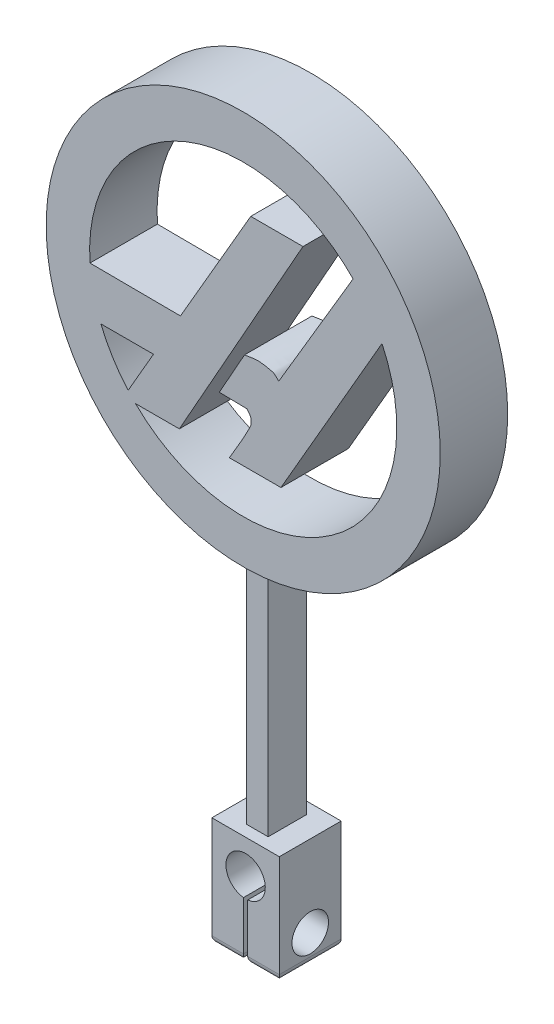
from build123d import *

# Parameters (mm, degrees)
JOINT_DEPTH         = 2.2
JOINT_DEPTH_BACK    = 2.2
SKETCH1_W           = 4.8
SKETCH1_H           = 7.77
SKETCH2_W           = 1.55
SKETCH2_H           = 2.74
ARM_DEPTH           = 19.2
MOTSHAFT_DEPTH      = 2.2
MOTSHAFT_DEPTH_BACK = 2.2
SKETCH3_R           = 1.4
BOLT_DEPTH          = 2.4
BOLT_DEPTH_BACK     = 2.4
SKETCH4_R           = 1.3
SLOT_DEPTH          = 2.4
SLOT_DEPTH_BACK     = 2.4
SKETCH5_W           = 0.3
SKETCH5_H           = 4.750114644
LOGO_DEPTH          = 2.4
LOGO_DEPTH_BACK     = 2.4
SKETCH6_R           = 14.025069588
FILLET2_R           = 0.5


with BuildPart() as part:
    # Sketch1 → Joint (new, two sides: drawn at the far end of the back side and taken through both)
    with BuildSketch(Plane.XY.offset(-JOINT_DEPTH_BACK)):
        with Locations((0, -1.485)):
            Rectangle(SKETCH1_W, SKETCH1_H)
    extrude(amount=JOINT_DEPTH + JOINT_DEPTH_BACK)

    # Sketch2 → Arm (add)
    with BuildSketch(Plane(origin=(0, 0, 0), x_dir=(1, 0, 0), z_dir=(0, 1, 0))):
        Rectangle(SKETCH2_W, SKETCH2_H)
    extrude(amount=ARM_DEPTH)

    # Sketch3 → MotShaft (cut, two sides: drawn at the far end of the back side and taken through both)
    with BuildSketch(Plane.XY.offset(-MOTSHAFT_DEPTH_BACK)):
        Circle(SKETCH3_R)
    extrude(amount=MOTSHAFT_DEPTH + MOTSHAFT_DEPTH_BACK, mode=Mode.SUBTRACT)

    # Sketch4 → Bolt (cut, two sides: drawn at the far end of the back side and taken through both)
    with BuildSketch(Plane(origin=(0, 0, 0), x_dir=(0, 0, -1), z_dir=(1, 0, 0)).offset(-BOLT_DEPTH_BACK)):
        with Locations((0, -3.385)):
            Circle(SKETCH4_R)
    extrude(amount=BOLT_DEPTH + BOLT_DEPTH_BACK, mode=Mode.SUBTRACT)

    # Sketch5 → Slot (cut, two sides: drawn at the far end of the back side and taken through both)
    with BuildSketch(Plane.XY.offset(-SLOT_DEPTH_BACK)):
        with Locations((0, -2.994942678)):
            Rectangle(SKETCH5_W, SKETCH5_H)
    extrude(amount=SLOT_DEPTH + SLOT_DEPTH_BACK, mode=Mode.SUBTRACT)

    # Sketch6 → Logo (add, two sides: drawn at the far end of the back side and taken through both)
    with BuildSketch(Plane.XY.offset(-LOGO_DEPTH_BACK)):
        with Locations((0.028663205, 33.205197547)):
            Circle(SKETCH6_R)
        with BuildLine():
            Line((7.850682171, 40.84118221), (2.563301931, 31.893307958))
            add(Edge.make_bspline(
                [(2.563301931, 31.893307958), (2.403301931, 32.013307958), (2.277561394, 32.205734212), (2.083301931, 32.253307958), (1.095069191, 32.49532414), (0.877371677, 32.418986249), (0.123301931, 32.293307958)],
                knots=[0, 0, 0, 0, 1, 1, 1, 2, 2, 2, 2], degree=3))
            Line((0.123301931, 32.293307958), (-1.670573626, 29.093307958))
            Line((-1.670573626, 29.093307958), (0.283301931, 29.053307958))
            add(Edge.make_bspline(
                [(0.283301931, 29.053307958), (0.376635265, 28.919974625), (0.525319532, 28.811567954), (0.563301931, 28.653307958), (0.610080128, 28.458398805), (0.608434529, 28.234774811), (0.523301931, 28.053307958), (0.094823061, 27.139971418), (-0.463364735, 26.293307958), (-0.956698069, 25.413307958)],
                knots=[0, 0, 0, 0, 1, 1, 1, 2, 2, 2, 3, 3, 3, 3], degree=3))
            Line((-0.956698069, 25.413307958), (2.714650894, 25.413307958))
            Line((2.714650894, 25.413307958), (9.907603307, 37.884811305))
            ThreePointArc((9.907603307, 37.884811305), (6.362466937, 24.295923012), (-7.636820846, 25.412085413))
            Line((-7.636820846, 25.412085413), (-4.516721863, 25.413307958))
            Line((-4.516721863, 25.413307958), (4.283301931, 41.053307959))
            Line((4.283301931, 41.053307959), (0.566531982, 41.053307959))
            Line((0.566531982, 41.053307959), (-4.436698069, 32.413307959))
            Line((-4.436698069, 32.413307959), (-10.876698069, 32.453307959))
            ThreePointArc((-10.876698069, 32.453307959), (-4.43965399, 43.181488637), (7.850682171, 40.84118221))
        make_face(mode=Mode.SUBTRACT)
        with BuildLine():
            Line((-10.099742715, 29.093307958), (-6.356698069, 29.093307958))
            Line((-6.356698069, 29.093307958), (-8.161326075, 25.96528608))
            ThreePointArc((-8.161326075, 25.96528608), (-9.26310901, 27.447141315), (-10.099742715, 29.093307958))
        make_face(mode=Mode.SUBTRACT)
    extrude(amount=LOGO_DEPTH + LOGO_DEPTH_BACK)

    # Fillet2
    fillet2_edges = [part.edges().sort_by_distance(p)[0] for p in [
        (-1.275, -5.37, -2.2),
        (-2.4, -5.37, 0),
        (-1.275, -5.37, 2.2),
        (-0.15, -5.37, 0),
        (1.275, -5.37, 2.2),
        (2.4, -5.37, 0),
        (1.275, -5.37, -2.2),
        (0.15, -5.37, 0),
    ]]
    fillet(fillet2_edges, radius=FILLET2_R)


solid = part.part
